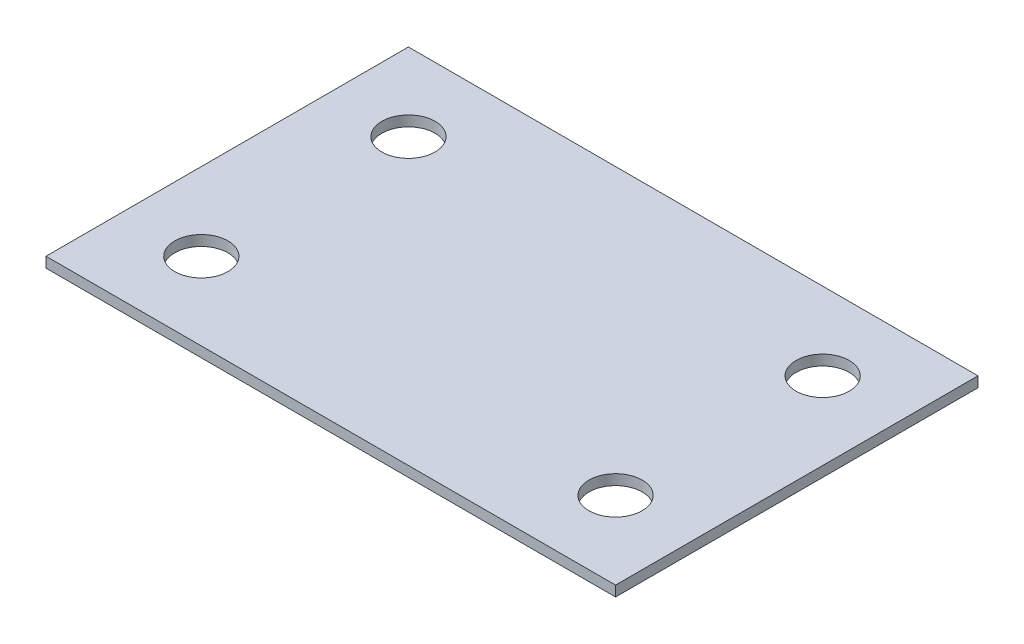
from build123d import *

# Parameters (mm, degrees)
SKETCH1_W           = 69.85
SKETCH1_H           = 44.45
SKETCH1_R           = 3.2639
BOSS_EXTRUDE1_DEPTH = 1.27


with BuildPart() as part:
    # Sketch1 → Boss-Extrude1 (new body)
    with BuildSketch(Plane(origin=(0, 0, 0), x_dir=(1, 0, 0), z_dir=(0, 1, 0))):
        with Locations((34.925, 22.225)):
            Rectangle(SKETCH1_W, SKETCH1_H)
        with Locations((9.525, 34.925)):
            Circle(SKETCH1_R, mode=Mode.SUBTRACT)
        with Locations((60.325, 34.925)):
            Circle(SKETCH1_R, mode=Mode.SUBTRACT)
        with Locations((9.525, 9.525)):
            Circle(SKETCH1_R, mode=Mode.SUBTRACT)
        with Locations((60.325, 9.525)):
            Circle(SKETCH1_R, mode=Mode.SUBTRACT)
    extrude(amount=BOSS_EXTRUDE1_DEPTH)


solid = part.part
